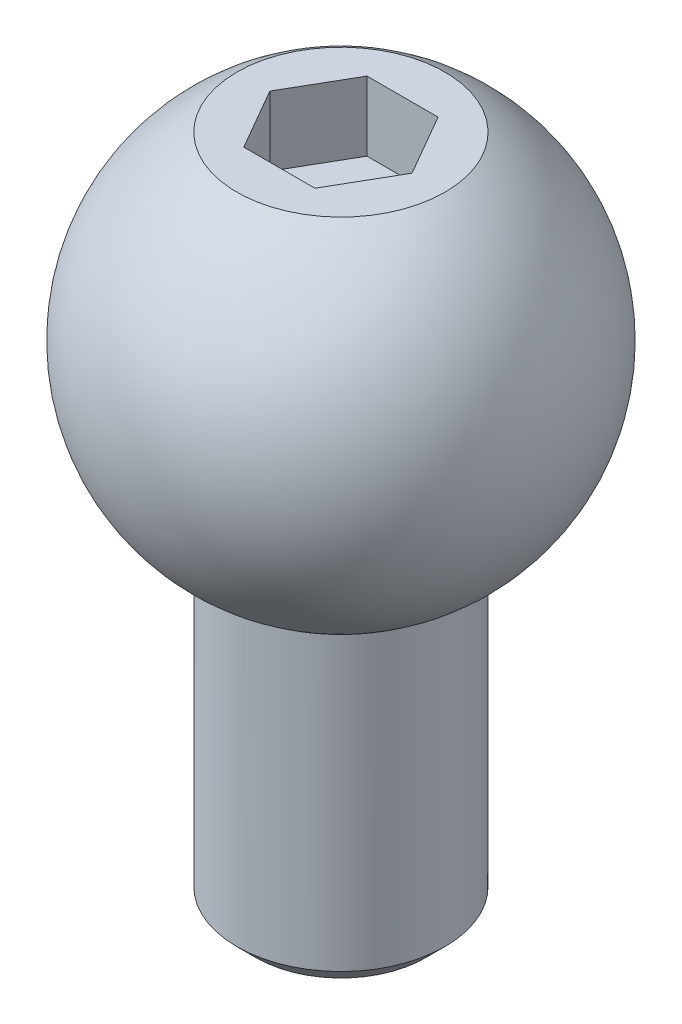
from build123d import *

# Parameters (mm, degrees)
CUT_EXTRUDE1_DEPTH = 2


# Read off the part's stored shape, not the designer's step: M6x1.0 Machine Threads Stud1
with BuildPart() as part:
    # Sketch1 → Revolve1 (revolve)
    with BuildSketch(Plane.XY, mode=Mode.PRIVATE) as revolve1_sk:
        with BuildLine():
            Line((0, -16.59536458), (0, 2.796940265))
            Line((0, 2.796940265), (3, 2.796940265))
            ThreePointArc((3, 2.796940265), (6, -2.399212157), (3, -7.59536458))
            Line((3, -7.59536458), (3, -16.59536458))
            Line((3, -16.59536458), (0, -16.59536458))
        make_face()
    revolve(revolve1_sk.sketch.rotate(Axis((0, -16.59536458, 0), (0, 1, 0)), 90), axis=Axis((0, -16.59536458, 0), (0, 1, 0)))

    # Sketch4 → Cut-Extrude1 (cut)
    with BuildSketch(Plane(origin=(0, 2.796940265, 0), x_dir=(1, 0, 0), z_dir=(0, 1, 0))):
        Polygon((-2.05, 0), (-1.025, -1.775352078), (1.025, -1.775352078), (2.05, 0), (1.025, 1.775352078), (-1.025, 1.775352078), align=None)
    extrude(amount=-CUT_EXTRUDE1_DEPTH, mode=Mode.SUBTRACT)

    # M6x1.0 Machine Threads Stud1 outline → M6x1.0 Machine Threads Stud1 (revolve, cut)
    with BuildSketch(Plane.XY):
        Polygon((3, -16.04086458), (2.4455, -16.59536458), (3, -16.59536458), align=None)
    revolve(axis=Axis((0, 0, 0), (0, 1, 0)), mode=Mode.SUBTRACT)


solid = part.part
